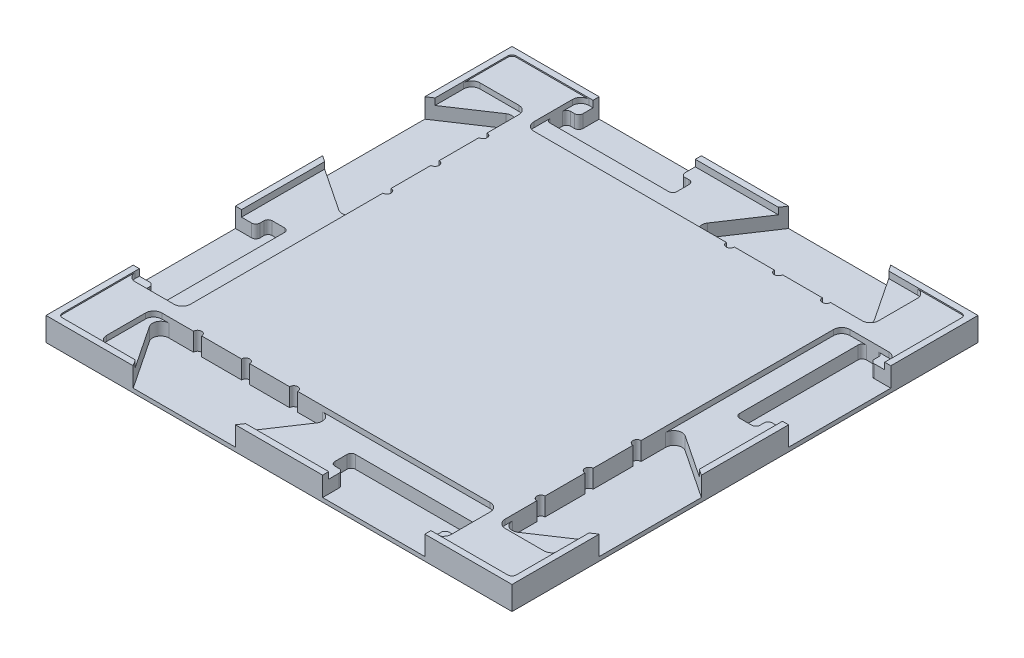
from build123d import *

# Parameters (mm, degrees)
SKETCH1_W           = 114
SKETCH1_H           = 114
BOSS_EXTRUDE1_DEPTH = 2.875
SKETCH2_W           = 111
SKETCH2_H           = 111
CUT_EXTRUDE1_DEPTH  = 0.3
CUT_EXTRUDE2_START  = -4.75
CUT_EXTRUDE2_DEPTH  = 86.564989327
CUT_EXTRUDE4_DEPTH  = 4.45
SKETCH9_W           = 84.333333334
SKETCH9_H           = 13.5
CUT_EXTRUDE5_DEPTH  = 1.3
FILLET1_R           = 1
FILLET3_R           = 2
FILLET4_R           = 2
CIRPATTERN1_START   = -1.875
CIRPATTERN1_DEPTH   = 4.75
CIRPATTERN1_START_2 = 1.275
CIRPATTERN1_2_DEPTH = 1.3


# Read off the part's stored shape, not the designer's step: CirPattern1
with BuildPart() as part:
    # Sketch1 → Boss-Extrude1 (new, symmetric)
    with BuildSketch(Plane(origin=(0, 0, 0), x_dir=(1, 0, 0), z_dir=(0, 1, 0))):
        Rectangle(SKETCH1_W, SKETCH1_H)
    extrude(amount=BOSS_EXTRUDE1_DEPTH, both=True)

    # Sketch2 → Cut-Extrude1 (cut)
    with BuildSketch(Plane(origin=(0, 2.875, 0), x_dir=(1, 0, 0), z_dir=(0, 1, 0))):
        Rectangle(SKETCH2_W, SKETCH2_H)
    extrude(amount=-CUT_EXTRUDE1_DEPTH, mode=Mode.SUBTRACT)

    # Sketch4 → Cut-Extrude2 (cut)
    with BuildSketch(Plane(origin=(0, 2.875, 0), x_dir=(1, 0, 0), z_dir=(0, 1, 0)).offset(CUT_EXTRUDE2_START)):
        Polygon((-35.666666667, -57), (-45.666666667, -42), (-0.666666667, -42), (-10.666666667, -57), align=None)
        Polygon((10.666666667, -57), (10.666666667, -52), (7.666666667, -52), (7.666666667, -47), (38.666666667, -47), (38.666666667, -52), (35.666666667, -52), (35.666666667, -57), align=None)
    extrude(amount=CUT_EXTRUDE2_DEPTH, mode=Mode.SUBTRACT)

    # Sketch6 → Cut-Extrude4 (cut)
    with BuildSketch(Plane(origin=(0, 2.575, 0), x_dir=(1, 0, 0), z_dir=(0, 1, 0))):
        with BuildLine():
            Line((-35.916666667, -42), (-33.916666667, -42))
            ThreePointArc((-33.916666667, -42), (-34.916666667, -41), (-35.916666667, -42))
        make_face()
        with BuildLine():
            Line((-24.166666667, -42), (-22.166666667, -42))
            ThreePointArc((-22.166666667, -42), (-23.166666667, -41), (-24.166666667, -42))
        make_face()
        with BuildLine():
            Line((-12.416666667, -42), (-10.416666667, -42))
            ThreePointArc((-10.416666667, -42), (-11.416666667, -41), (-12.416666667, -42))
        make_face()
    extrude(amount=-CUT_EXTRUDE4_DEPTH, mode=Mode.SUBTRACT)

    # Sketch9 → Cut-Extrude5 (cut)
    with BuildSketch(Plane(origin=(0, 2.575, 0), x_dir=(1, 0, 0), z_dir=(0, 1, 0))):
        with Locations((-3.5, -48.75)):
            Rectangle(SKETCH9_W, SKETCH9_H)
    extrude(amount=-CUT_EXTRUDE5_DEPTH, mode=Mode.SUBTRACT)

    # Fillet1
    fillet1_edges = [part.edges().sort_by_distance(p)[0] for p in [
        (-55.5, 2.725, -55.5),
        (-55.5, 2.725, 55.5),
        (55.5, 2.725, 55.5),
        (55.5, 2.725, -55.5),
        (38.666666667, -0.3, 52),
        (38.666666667, -0.3, 47),
        (7.666666667, -0.3, 47),
        (7.666666667, -0.3, 52),
        (10.666666667, -0.3, 52),
        (35.666666667, -0.3, 52),
    ]]
    fillet(fillet1_edges, radius=FILLET1_R)

    # Fillet3
    fillet3_edges = [part.edges().sort_by_distance(p)[0] for p in [
        (-45.666666667, -0.3, 42),
        (-0.666666667, -0.3, 42),
    ]]
    fillet(fillet3_edges, radius=FILLET3_R)

    # Fillet4
    fillet4_edges = [part.edges().sort_by_distance(p)[0] for p in [
        (38.666666667, 1.925, 42),
        (38.666666667, 1.925, 55.5),
        (-45.666666667, 1.925, 42),
        (-45.666666667, 1.925, 55.5),
    ]]
    fillet(fillet4_edges, radius=FILLET4_R)

    # CirPattern1 outline → CirPattern1 (cut)
    with BuildSketch(Plane(origin=(0, 0, 0), x_dir=(1, 0, 0), z_dir=(0, 1, 0)).offset(CIRPATTERN1_START)):
        with BuildLine():
            ThreePointArc((42, -10.416666667), (41, -11.416666667), (42, -12.416666667))
            Line((42, -12.416666667), (42, -22.166666667))
            ThreePointArc((42, -22.166666667), (41, -23.166666667), (42, -24.166666667))
            Line((42, -24.166666667), (42, -33.916666667))
            ThreePointArc((42, -33.916666667), (41, -34.916666667), (42, -35.916666667))
            Line((42, -35.916666667), (42, -41.929632483))
            ThreePointArc((42, -41.929632483), (43.056284149, -43.692981681), (45.109400392, -43.593733072))
            Line((45.109400392, -43.593733072), (57, -35.666666667))
            Line((57, -35.666666667), (57, -10.666666667))
            Line((57, -10.666666667), (45.109400392, -2.739600262))
            ThreePointArc((45.109400392, -2.739600262), (43.056284149, -2.640351653), (42, -4.40370085))
            Line((42, -4.40370085), (42, -10.416666667))
        make_face()
        with BuildLine():
            Line((-57, 35.666666667), (-57, 10.666666667))
            Line((-57, 10.666666667), (-45.109400392, 2.739600262))
            ThreePointArc((-45.109400392, 2.739600262), (-43.056284149, 2.640351653), (-42, 4.40370085))
            Line((-42, 4.40370085), (-42, 10.416666667))
            ThreePointArc((-42, 10.416666667), (-41, 11.416666667), (-42, 12.416666667))
            Line((-42, 12.416666667), (-42, 22.166666667))
            ThreePointArc((-42, 22.166666667), (-41, 23.166666667), (-42, 24.166666667))
            Line((-42, 24.166666667), (-42, 33.916666667))
            ThreePointArc((-42, 33.916666667), (-41, 34.916666667), (-42, 35.916666667))
            Line((-42, 35.916666667), (-42, 41.929632483))
            ThreePointArc((-42, 41.929632483), (-43.056284149, 43.692981681), (-45.109400392, 43.593733072))
            Line((-45.109400392, 43.593733072), (-57, 35.666666667))
        make_face()
        with BuildLine():
            Line((35.666666667, 57), (10.666666667, 57))
            Line((10.666666667, 57), (2.739600262, 45.109400392))
            ThreePointArc((2.739600262, 45.109400392), (2.640351653, 43.056284149), (4.40370085, 42))
            Line((4.40370085, 42), (10.416666667, 42))
            ThreePointArc((10.416666667, 42), (11.416666667, 41), (12.416666667, 42))
            Line((12.416666667, 42), (22.166666667, 42))
            ThreePointArc((22.166666667, 42), (23.166666667, 41), (24.166666667, 42))
            Line((24.166666667, 42), (33.916666667, 42))
            ThreePointArc((33.916666667, 42), (34.916666667, 41), (35.916666667, 42))
            Line((35.916666667, 42), (41.929632483, 42))
            ThreePointArc((41.929632483, 42), (43.692981681, 43.056284149), (43.593733072, 45.109400392))
            Line((43.593733072, 45.109400392), (35.666666667, 57))
        make_face()
        with BuildLine():
            Line((51, 38.666666667), (48, 38.666666667))
            ThreePointArc((48, 38.666666667), (47.292893219, 38.373773448), (47, 37.666666667))
            Line((47, 37.666666667), (47, 8.666666667))
            ThreePointArc((47, 8.666666667), (47.292893218, 7.959559885), (48, 7.666666667))
            Line((48, 7.666666667), (51, 7.666666667))
            ThreePointArc((51, 7.666666667), (51.707106782, 7.959559885), (52, 8.666666667))
            Line((52, 8.666666667), (52, 9.666666667))
            ThreePointArc((52, 9.666666667), (52.292893219, 10.373773448), (53, 10.666666667))
            Line((53, 10.666666667), (57, 10.666666667))
            Line((57, 10.666666667), (57, 35.666666667))
            Line((57, 35.666666667), (53, 35.666666667))
            ThreePointArc((53, 35.666666667), (52.292893218, 35.959559885), (52, 36.666666667))
            Line((52, 36.666666667), (52, 37.666666667))
            ThreePointArc((52, 37.666666667), (51.707106781, 38.373773448), (51, 38.666666667))
        make_face()
        with BuildLine():
            Line((-10.666666667, 57), (-35.666666667, 57))
            Line((-35.666666667, 57), (-35.666666667, 53))
            ThreePointArc((-35.666666667, 53), (-35.959559885, 52.292893218), (-36.666666667, 52))
            Line((-36.666666667, 52), (-37.666666667, 52))
            ThreePointArc((-37.666666667, 52), (-38.373773448, 51.707106781), (-38.666666667, 51))
            Line((-38.666666667, 51), (-38.666666667, 48))
            ThreePointArc((-38.666666667, 48), (-38.373773448, 47.292893219), (-37.666666667, 47))
            Line((-37.666666667, 47), (-8.666666667, 47))
            ThreePointArc((-8.666666667, 47), (-7.959559885, 47.292893218), (-7.666666667, 48))
            Line((-7.666666667, 48), (-7.666666667, 51))
            ThreePointArc((-7.666666667, 51), (-7.959559885, 51.707106782), (-8.666666667, 52))
            Line((-8.666666667, 52), (-9.666666667, 52))
            ThreePointArc((-9.666666667, 52), (-10.373773448, 52.292893219), (-10.666666667, 53))
            Line((-10.666666667, 53), (-10.666666667, 57))
        make_face()
        with BuildLine():
            Line((-57, -10.666666667), (-57, -35.666666667))
            Line((-57, -35.666666667), (-53, -35.666666667))
            ThreePointArc((-53, -35.666666667), (-52.292893218, -35.959559885), (-52, -36.666666667))
            Line((-52, -36.666666667), (-52, -37.666666667))
            ThreePointArc((-52, -37.666666667), (-51.707106781, -38.373773448), (-51, -38.666666667))
            Line((-51, -38.666666667), (-48, -38.666666667))
            ThreePointArc((-48, -38.666666667), (-47.292893219, -38.373773448), (-47, -37.666666667))
            Line((-47, -37.666666667), (-47, -8.666666667))
            ThreePointArc((-47, -8.666666667), (-47.292893218, -7.959559885), (-48, -7.666666667))
            Line((-48, -7.666666667), (-51, -7.666666667))
            ThreePointArc((-51, -7.666666667), (-51.707106782, -7.959559885), (-52, -8.666666667))
            Line((-52, -8.666666667), (-52, -9.666666667))
            ThreePointArc((-52, -9.666666667), (-52.292893219, -10.373773448), (-53, -10.666666667))
            Line((-53, -10.666666667), (-57, -10.666666667))
        make_face()
    extrude(amount=CIRPATTERN1_DEPTH, mode=Mode.SUBTRACT)

    # CirPattern1 2 outline → CirPattern1 2 (cut)
    with BuildSketch(Plane(origin=(0, 0, 0), x_dir=(1, 0, 0), z_dir=(0, 1, 0)).offset(CIRPATTERN1_START_2)):
        with BuildLine():
            Line((42, 36.666666667), (42, -4.40370085))
            ThreePointArc((42, -4.40370085), (43.056284149, -2.640351653), (45.109400392, -2.739600262))
            Line((45.109400392, -2.739600262), (55.5, -9.666666667))
            Line((55.5, -9.666666667), (55.5, 10.666666667))
            Line((55.5, 10.666666667), (53, 10.666666667))
            ThreePointArc((53, 10.666666667), (52.292893219, 10.373773448), (52, 9.666666667))
            Line((52, 9.666666667), (52, 8.666666667))
            ThreePointArc((52, 8.666666667), (51.707106782, 7.959559885), (51, 7.666666667))
            Line((51, 7.666666667), (48, 7.666666667))
            ThreePointArc((48, 7.666666667), (47.292893218, 7.959559885), (47, 8.666666667))
            Line((47, 8.666666667), (47, 37.666666667))
            ThreePointArc((47, 37.666666667), (47.292893219, 38.373773448), (48, 38.666666667))
            Line((48, 38.666666667), (44, 38.666666667))
            ThreePointArc((44, 38.666666667), (42.585786438, 38.080880229), (42, 36.666666667))
        make_face()
        with BuildLine():
            ThreePointArc((45.109400392, -43.593733072), (43.056284149, -43.692981681), (42, -41.929632483))
            Line((42, -41.929632483), (42, -43.666666667))
            ThreePointArc((42, -43.666666667), (42.585786438, -45.080880229), (44, -45.666666667))
            Line((44, -45.666666667), (53.5, -45.666666667))
            ThreePointArc((53.5, -45.666666667), (54.914213562, -45.080880229), (55.5, -43.666666667))
            Line((55.5, -43.666666667), (55.5, -36.666666667))
            Line((55.5, -36.666666667), (45.109400392, -43.593733072))
        make_face()
        with BuildLine():
            Line((53.5, 38.666666667), (51, 38.666666667))
            ThreePointArc((51, 38.666666667), (51.707106781, 38.373773448), (52, 37.666666667))
            Line((52, 37.666666667), (52, 36.666666667))
            ThreePointArc((52, 36.666666667), (52.292893218, 35.959559885), (53, 35.666666667))
            Line((53, 35.666666667), (55.5, 35.666666667))
            Line((55.5, 35.666666667), (55.5, 36.666666667))
            ThreePointArc((55.5, 36.666666667), (54.914213562, 38.080880229), (53.5, 38.666666667))
        make_face()
        with BuildLine():
            Line((43.666666667, 55.5), (36.666666667, 55.5))
            Line((36.666666667, 55.5), (43.593733072, 45.109400392))
            ThreePointArc((43.593733072, 45.109400392), (43.692981681, 43.056284149), (41.929632483, 42))
            Line((41.929632483, 42), (43.666666667, 42))
            ThreePointArc((43.666666667, 42), (45.080880229, 42.585786438), (45.666666667, 44))
            Line((45.666666667, 44), (45.666666667, 53.5))
            ThreePointArc((45.666666667, 53.5), (45.080880229, 54.914213562), (43.666666667, 55.5))
        make_face()
        with BuildLine():
            Line((2.739600262, 45.109400392), (9.666666667, 55.5))
            Line((9.666666667, 55.5), (-10.666666667, 55.5))
            Line((-10.666666667, 55.5), (-10.666666667, 53))
            ThreePointArc((-10.666666667, 53), (-10.373773448, 52.292893219), (-9.666666667, 52))
            Line((-9.666666667, 52), (-8.666666667, 52))
            ThreePointArc((-8.666666667, 52), (-7.959559885, 51.707106782), (-7.666666667, 51))
            Line((-7.666666667, 51), (-7.666666667, 48))
            ThreePointArc((-7.666666667, 48), (-7.959559885, 47.292893218), (-8.666666667, 47))
            Line((-8.666666667, 47), (-37.666666667, 47))
            ThreePointArc((-37.666666667, 47), (-38.373773448, 47.292893219), (-38.666666667, 48))
            Line((-38.666666667, 48), (-38.666666667, 44))
            ThreePointArc((-38.666666667, 44), (-38.080880229, 42.585786438), (-36.666666667, 42))
            Line((-36.666666667, 42), (4.40370085, 42))
            ThreePointArc((4.40370085, 42), (2.640351653, 43.056284149), (2.739600262, 45.109400392))
        make_face()
        with BuildLine():
            Line((-35.666666667, 53), (-35.666666667, 55.5))
            Line((-35.666666667, 55.5), (-36.666666667, 55.5))
            ThreePointArc((-36.666666667, 55.5), (-38.080880229, 54.914213562), (-38.666666667, 53.5))
            Line((-38.666666667, 53.5), (-38.666666667, 51))
            ThreePointArc((-38.666666667, 51), (-38.373773448, 51.707106781), (-37.666666667, 52))
            Line((-37.666666667, 52), (-36.666666667, 52))
            ThreePointArc((-36.666666667, 52), (-35.959559885, 52.292893218), (-35.666666667, 53))
        make_face()
        with BuildLine():
            Line((-55.5, 43.666666667), (-55.5, 36.666666667))
            Line((-55.5, 36.666666667), (-45.109400392, 43.593733072))
            ThreePointArc((-45.109400392, 43.593733072), (-43.056284149, 43.692981681), (-42, 41.929632483))
            Line((-42, 41.929632483), (-42, 43.666666667))
            ThreePointArc((-42, 43.666666667), (-42.585786438, 45.080880229), (-44, 45.666666667))
            Line((-44, 45.666666667), (-53.5, 45.666666667))
            ThreePointArc((-53.5, 45.666666667), (-54.914213562, 45.080880229), (-55.5, 43.666666667))
        make_face()
        with BuildLine():
            Line((-45.109400392, 2.739600262), (-55.5, 9.666666667))
            Line((-55.5, 9.666666667), (-55.5, -10.666666667))
            Line((-55.5, -10.666666667), (-53, -10.666666667))
            ThreePointArc((-53, -10.666666667), (-52.292893219, -10.373773448), (-52, -9.666666667))
            Line((-52, -9.666666667), (-52, -8.666666667))
            ThreePointArc((-52, -8.666666667), (-51.707106782, -7.959559885), (-51, -7.666666667))
            Line((-51, -7.666666667), (-48, -7.666666667))
            ThreePointArc((-48, -7.666666667), (-47.292893218, -7.959559885), (-47, -8.666666667))
            Line((-47, -8.666666667), (-47, -37.666666667))
            ThreePointArc((-47, -37.666666667), (-47.292893219, -38.373773448), (-48, -38.666666667))
            Line((-48, -38.666666667), (-44, -38.666666667))
            ThreePointArc((-44, -38.666666667), (-42.585786438, -38.080880229), (-42, -36.666666667))
            Line((-42, -36.666666667), (-42, 4.40370085))
            ThreePointArc((-42, 4.40370085), (-43.056284149, 2.640351653), (-45.109400392, 2.739600262))
        make_face()
        with BuildLine():
            Line((-53, -35.666666667), (-55.5, -35.666666667))
            Line((-55.5, -35.666666667), (-55.5, -36.666666667))
            ThreePointArc((-55.5, -36.666666667), (-54.914213562, -38.080880229), (-53.5, -38.666666667))
            Line((-53.5, -38.666666667), (-51, -38.666666667))
            ThreePointArc((-51, -38.666666667), (-51.707106781, -38.373773448), (-52, -37.666666667))
            Line((-52, -37.666666667), (-52, -36.666666667))
            ThreePointArc((-52, -36.666666667), (-52.292893218, -35.959559885), (-53, -35.666666667))
        make_face()
    extrude(amount=CIRPATTERN1_2_DEPTH, mode=Mode.SUBTRACT)


solid = part.part
